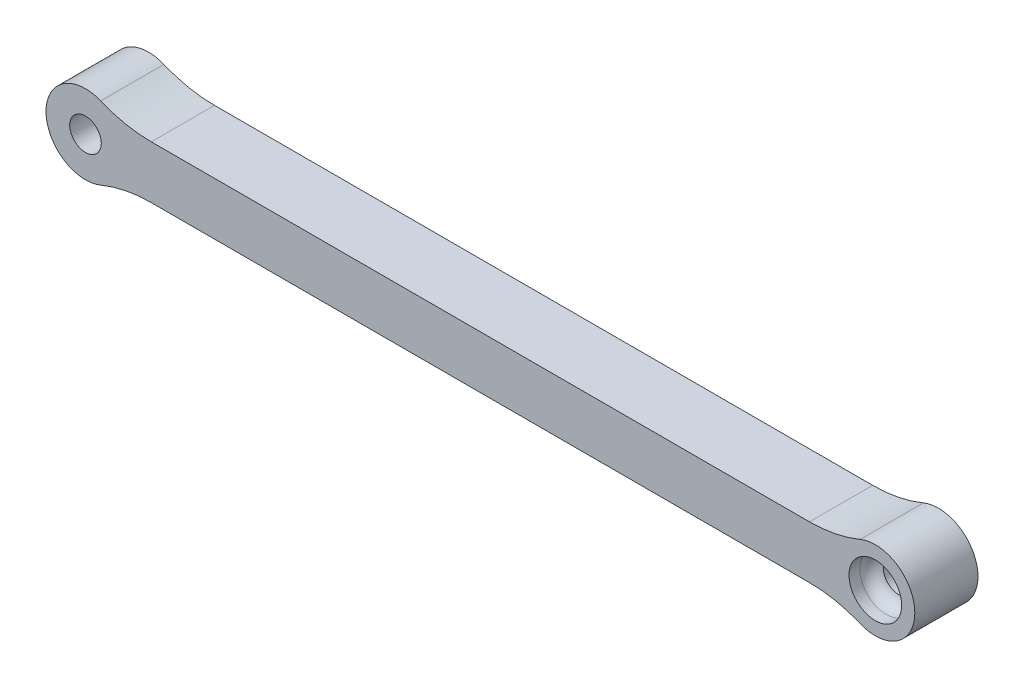
from build123d import *

# Parameters (mm, degrees)
SKETCH1_R           = 1.2
BOSS_EXTRUDE1_DEPTH = 4.8
SKETCH2_R           = 2
CUT_EXTRUDE1_DEPTH  = 1.8
FILLET1_R           = 1


with BuildPart() as part:
    # Sketch1 → Boss-Extrude1 (new body)
    with BuildSketch(Plane.XY):
        with BuildLine():
            Line((5, -2), (55, -2))
            ThreePointArc((55, -2), (56.961161351, -2.194193243), (58.846153846, -2.769230769))
            ThreePointArc((58.846153846, -2.769230769), (63, 0), (58.846153846, 2.769230769))
            ThreePointArc((58.846153846, 2.769230769), (56.961161351, 2.194193243), (55, 2))
            Line((55, 2), (5, 2))
            ThreePointArc((5, 2), (3.038838649, 2.194193243), (1.153846154, 2.769230769))
            ThreePointArc((1.153846154, 2.769230769), (-3, 0), (1.153846154, -2.769230769))
            ThreePointArc((1.153846154, -2.769230769), (3.038838649, -2.194193243), (5, -2))
        make_face()
        Circle(SKETCH1_R, mode=Mode.SUBTRACT)
        with Locations((60, 0)):
            Circle(SKETCH1_R, mode=Mode.SUBTRACT)
    extrude(amount=BOSS_EXTRUDE1_DEPTH)

    # Sketch2 → Cut-Extrude1 (cut)
    with BuildSketch(Plane.XY.offset(4.8)):
        with Locations((60, 0)):
            Circle(SKETCH2_R)
    extrude(amount=-CUT_EXTRUDE1_DEPTH, mode=Mode.SUBTRACT)

    # Fillet1
    # the kernel refuses this fillet: 1 mm, written as the material it adds along each edge
    with BuildSketch(Plane(origin=(60, 0, 3), x_dir=(1, 0, 0), z_dir=(0, -1, 0))) as fillet1_piece_1:
        with BuildLine():
            CenterArc((1, 0.979795897), FILLET1_R, 281.536959033, 78.463040967)
            Line((1.2, 0), (1.204, -0.019595918))
            ThreePointArc((1.204, -0.019595918), (1.6, -0.02), (2, -0.02))
            Line((2, -0.02), (2.02, 0))
            Line((2.02, 0), (2.02, 0.979795897))
            Line((2.02, 0.979795897), (2, 0.979795897))
        make_face()
    revolve(axis=Axis((60, 0, 3), (0, 0, 1)))


solid = part.part
